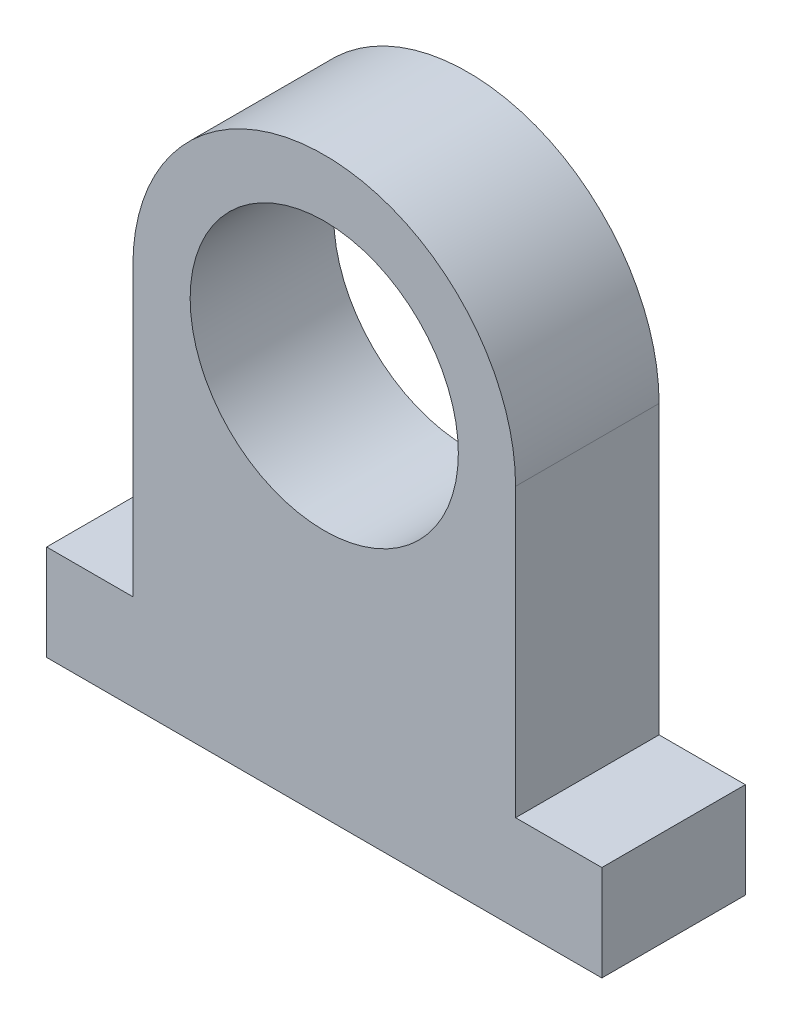
from build123d import *

# Parameters (mm, degrees)
SKETCH1_W           = 73.7
SKETCH1_H           = 19.05
BOSS_EXTRUDE2_DEPTH = 76.2
SKETCH2_R           = 17.8
CUT_EXTRUDE1_DEPTH  = 104.891229177


with BuildPart() as part:
    # Sketch1 → Boss-Extrude2 (new body)
    with BuildSketch(Plane(origin=(0, 19.05, 0), x_dir=(1, 0, 0), z_dir=(0, 1, 0))):
        with Locations((0, -87.9856)):
            Rectangle(SKETCH1_W, SKETCH1_H)
    extrude(amount=BOSS_EXTRUDE2_DEPTH)

    # Sketch2 → Cut-Extrude1 (cut, through all)
    with BuildSketch(Plane.XY.offset(97.5106)):
        with BuildLine():
            Line((-36.85, 95.25), (-36.85, 31.75))
            Line((-36.85, 31.75), (-25.4, 31.75))
            Line((-25.4, 31.75), (-25.4, 69.85))
            ThreePointArc((-25.4, 69.85), (-17.960512267, 87.810512217), (-7.1e-08, 95.25))
            Line((-7.1e-08, 95.25), (-36.85, 95.25))
        make_face()
        with BuildLine():
            Line((25.4, 69.85), (25.4, 31.75))
            Line((25.4, 31.75), (36.85, 31.75))
            Line((36.85, 31.75), (36.85, 95.25))
            Line((36.85, 95.25), (-7.1e-08, 95.25))
            ThreePointArc((-7.1e-08, 95.25), (17.960512217, 87.810512267), (25.4, 69.85))
        make_face()
        with Locations((0, 69.85)):
            Circle(SKETCH2_R)
    extrude(amount=-CUT_EXTRUDE1_DEPTH, mode=Mode.SUBTRACT)


solid = part.part
